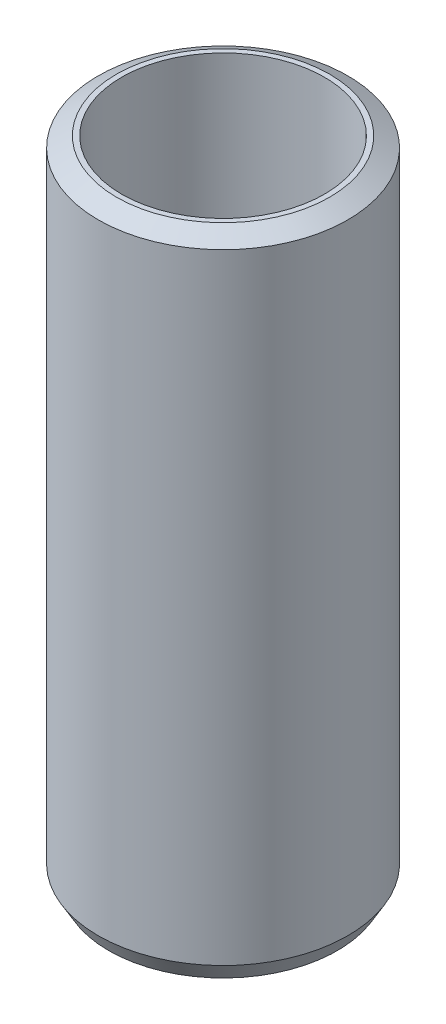
from build123d import *
from OCP.BRepFilletAPI import BRepFilletAPI_MakeChamfer

# Parameters (mm, degrees)
SKETCH1_R           = 40
BOSS_EXTRUDE1_DEPTH = 207.922944745
SKETCH2_R           = 32.501414581
CUT_EXTRUDE1_DEPTH  = 216.480743807
CHAMFER1_SIZE       = 3.370158333
CHAMFER1_SIZE2      = 5.837285461


with BuildPart() as part:
    # Sketch1 → Boss-Extrude1 (new body)
    with BuildSketch(Plane(origin=(0, 0, 0), x_dir=(1, 0, 0), z_dir=(0, 1, 0))):
        Circle(SKETCH1_R)
    extrude(amount=BOSS_EXTRUDE1_DEPTH)

    # Sketch2 → Cut-Extrude1 (cut, through all)
    with BuildSketch(Plane(origin=(0, 0, 0), x_dir=(1, 0, 0), z_dir=(0, 1, 0))):
        Circle(SKETCH2_R)
    extrude(amount=CUT_EXTRUDE1_DEPTH, mode=Mode.SUBTRACT)

    # Chamfer1: one chamfer whose edges measure the first distance from different faces: ONE call of the kernel's chamfer builder (chamfer() names one face for all edges)
    chamfer1_edges_1 = [part.edges().sort_by_distance(p)[0] for p in [
        (-40, 207.922944745, 0),
    ]]
    chamfer1_side_1 = [part.faces().sort_by_distance(p)[0] for p in [
        (-40, 103.961472373, 0),
    ]]
    chamfer1_edges_2 = [part.edges().sort_by_distance(p)[0] for p in [
        (-40, 0, 0),
    ]]
    chamfer1_side_2 = [part.faces().sort_by_distance(p)[0] for p in [
        (-38.86862915, 0, 0),
    ]]
    chamfer1 = BRepFilletAPI_MakeChamfer(part.part.solid().wrapped)
    for e in chamfer1_edges_1:
        chamfer1.Add(CHAMFER1_SIZE, CHAMFER1_SIZE2, e.wrapped, chamfer1_side_1[0].wrapped)  # the first distance lies on this face
    for e in chamfer1_edges_2:
        chamfer1.Add(CHAMFER1_SIZE, CHAMFER1_SIZE2, e.wrapped, chamfer1_side_2[0].wrapped)  # the first distance lies on this face
    add(Compound.cast(chamfer1.Shape()), mode=Mode.REPLACE)


solid = part.part
